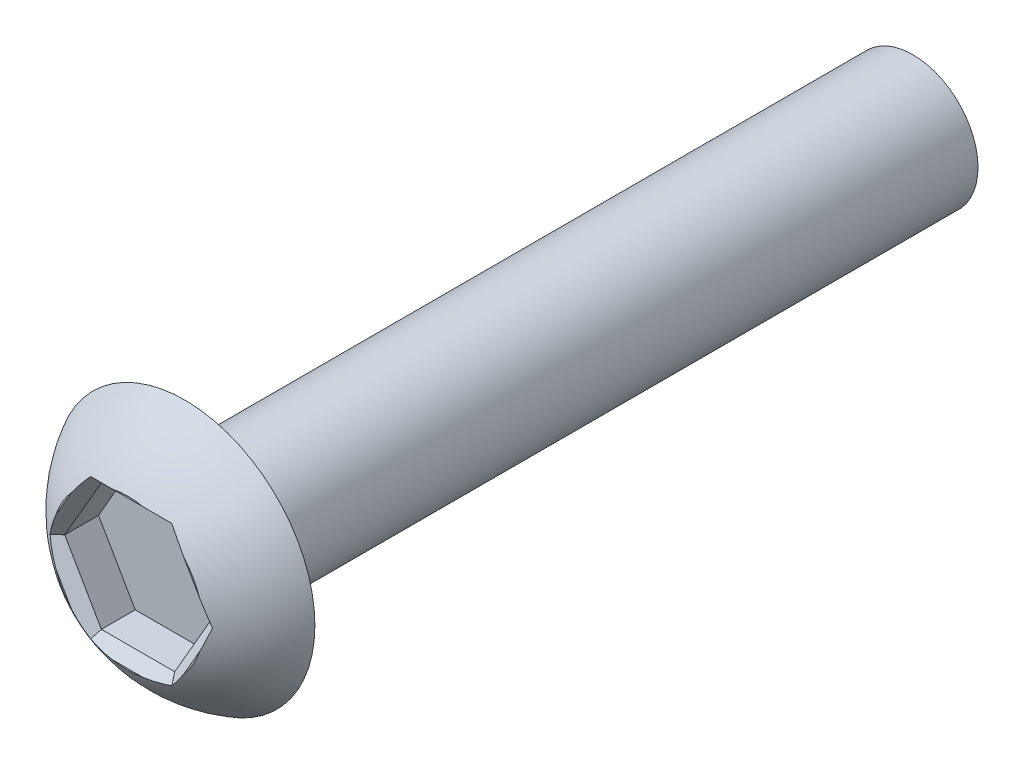
from build123d import *

# Parameters (mm, degrees)
SKETCH1_R               = 1.25
BOSS_EXTRUDE1_DEPTH     = 14
CUT_EXTRUDE1_DEPTH      = 1.25
CUT_EXTRUDE2_DEPTH      = 15.439529078
CUT_EXTRUDE2_DEPTH_BACK = 15.439529078
SKETCH6_W               = 1.249656436
SKETCH6_H               = 4.384153796
CHAMFER2_SIZE           = 0.2


with BuildPart() as part:
    # Sketch1 → Boss-Extrude1 (new body)
    with BuildSketch(Plane.XY):
        Circle(SKETCH1_R)
    extrude(amount=-BOSS_EXTRUDE1_DEPTH)

    # Sketch3 → Revolve1 (revolve)
    with BuildSketch(Plane(origin=(0, 0, 0), x_dir=(0, 0, -1), z_dir=(1, 0, 0)), mode=Mode.PRIVATE) as revolve1_sk:
        with BuildLine():
            ThreePointArc((-1.5, 0), (-1.096229956, 1.457737974), (0, 2.5))
            Line((0, 2.5), (0, 0))
            Line((0, 0), (-1.5, 0))
        make_face()
    revolve(revolve1_sk.sketch.rotate(Axis((0, 0, 1.5), (0, 0, -1)), 180), axis=Axis((0, 0, 1.5), (0, 0, -1)))

    # Sketch5 → Cut-Extrude1 (cut)
    with BuildSketch(Plane(origin=(0, 0, 1.5), x_dir=(-1, 0, 0), z_dir=(0, 0, -1))):
        Polygon((-1.409901945, 0), (-0.704950973, -1.221010901), (0.704950973, -1.221010901), (1.409901945, 0), (0.704950973, 1.221010901), (-0.704950973, 1.221010901), align=None)
    extrude(amount=CUT_EXTRUDE1_DEPTH, mode=Mode.SUBTRACT)

    # Sketch6 → Cut-Extrude2 (cut, two sides: drawn at the far end of the back side and taken through both)
    with BuildSketch(Plane(origin=(0, 0, 0), x_dir=(0, 0, -1), z_dir=(1, 0, 0)).offset(-CUT_EXTRUDE2_DEPTH_BACK)):
        with Locations((-1.724828218, 0.205450463)):
            Rectangle(SKETCH6_W, SKETCH6_H)
    extrude(amount=CUT_EXTRUDE2_DEPTH + CUT_EXTRUDE2_DEPTH_BACK, mode=Mode.SUBTRACT)

    # Chamfer2
    # the kernel refuses this chamfer: 0.2 mm, written as the material it takes off along each edge
    with BuildSketch(Plane(origin=(1.21928757, 1.221010901, 1.1), x_dir=(1.0390370186618431e-14, 0.9996219169112966, 0.02749587661058733), z_dir=(-1, 0, 0))) as chamfer2_piece_1_section:
        Polygon((CHAMFER2_SIZE * 0.999621916911, CHAMFER2_SIZE * 0.0274958766106), (-CHAMFER2_SIZE * 0.0274958766106, CHAMFER2_SIZE * 0.999621916911), (0, 0), align=None)
    chamfer2_piece_1 = extrude(amount=2.43857514, mode=Mode.PRIVATE)
    chamfer2_piece_1 = split(chamfer2_piece_1, bisect_by=Plane(origin=(0.501104512, 1.574083329, 1.032865614), z_dir=(-0.8660254037844416, -0.49999999999999495, 0)), keep=Keep.TOP, mode=Mode.PRIVATE)
    chamfer2_piece_1 = split(chamfer2_piece_1, bisect_by=Plane(origin=(-0.501104512, 1.574083329, 1.032865614), z_dir=(0.8660254037844347, -0.500000000000007, 0)), keep=Keep.TOP, mode=Mode.PRIVATE)
    add(chamfer2_piece_1, mode=Mode.SUBTRACT)
    with BuildSketch(Plane(origin=(1.667070244, -0.44542856, 1.1), x_dir=(0.8656979742248833, 0.4998109584556433, 0.027495876610586282), z_dir=(-0.49999999999999495, 0.8660254037844416, 0))) as chamfer2_piece_2_section:
        Polygon((CHAMFER2_SIZE * 0.999621916911, CHAMFER2_SIZE * 0.0274958766106), (-CHAMFER2_SIZE * 0.0274958766106, CHAMFER2_SIZE * 0.999621916911), (0, 0), align=None)
    chamfer2_piece_2 = extrude(amount=2.43857514, mode=Mode.PRIVATE)
    chamfer2_piece_2 = split(chamfer2_piece_2, bisect_by=Plane(origin=(1.613748406, 0.353072427, 1.032865614), z_dir=(-0.8660254037844382, 0.500000000000001, 0)), keep=Keep.TOP, mode=Mode.PRIVATE)
    chamfer2_piece_2 = split(chamfer2_piece_2, bisect_by=Plane(origin=(1.112643894, 1.221010901, 1.032865614), z_dir=(0, -1, 0)), keep=Keep.TOP, mode=Mode.PRIVATE)
    add(chamfer2_piece_2, mode=Mode.SUBTRACT)
    with BuildSketch(Plane(origin=(0.447782674, -1.666439461, 1.1), x_dir=(0.8656979742248797, -0.4998109584556493, 0.02749587661058626), z_dir=(0.500000000000001, 0.8660254037844382, 0))) as chamfer2_piece_3_section:
        Polygon((CHAMFER2_SIZE * 0.999621916911, CHAMFER2_SIZE * 0.0274958766106), (-CHAMFER2_SIZE * 0.0274958766106, CHAMFER2_SIZE * 0.999621916911), (0, 0), align=None)
    chamfer2_piece_3 = extrude(amount=2.43857514, mode=Mode.PRIVATE)
    chamfer2_piece_3 = split(chamfer2_piece_3, bisect_by=Plane(origin=(1.112643894, -1.221010901, 1.032865614), z_dir=(0, 1, 0)), keep=Keep.TOP, mode=Mode.PRIVATE)
    chamfer2_piece_3 = split(chamfer2_piece_3, bisect_by=Plane(origin=(1.613748406, -0.353072427, 1.032865614), z_dir=(-0.8660254037844416, -0.49999999999999495, 0)), keep=Keep.TOP, mode=Mode.PRIVATE)
    add(chamfer2_piece_3, mode=Mode.SUBTRACT)
    with BuildSketch(Plane(origin=(-1.21928757, -1.221010901, 1.1), x_dir=(-3.30602687756041e-15, -0.9996219169112968, 0.027495876610586285), z_dir=(1, 0, 0))) as chamfer2_piece_4_section:
        Polygon((CHAMFER2_SIZE * 0.999621916911, CHAMFER2_SIZE * 0.0274958766106), (-CHAMFER2_SIZE * 0.0274958766106, CHAMFER2_SIZE * 0.999621916911), (0, 0), align=None)
    chamfer2_piece_4 = extrude(amount=2.43857514, mode=Mode.PRIVATE)
    chamfer2_piece_4 = split(chamfer2_piece_4, bisect_by=Plane(origin=(-0.501104512, -1.574083329, 1.032865614), z_dir=(0.8660254037844417, 0.49999999999999484, 0)), keep=Keep.TOP, mode=Mode.PRIVATE)
    chamfer2_piece_4 = split(chamfer2_piece_4, bisect_by=Plane(origin=(0.501104512, -1.574083329, 1.032865614), z_dir=(-0.8660254037844382, 0.500000000000001, 0)), keep=Keep.TOP, mode=Mode.PRIVATE)
    add(chamfer2_piece_4, mode=Mode.SUBTRACT)
    with BuildSketch(Plane(origin=(-1.667070244, 0.44542856, 1.1), x_dir=(-0.8656979742248834, -0.4998109584556432, 0.027495876610586265), z_dir=(0.49999999999999484, -0.8660254037844417, 0))) as chamfer2_piece_5_section:
        Polygon((CHAMFER2_SIZE * 0.999621916911, CHAMFER2_SIZE * 0.0274958766106), (-CHAMFER2_SIZE * 0.0274958766106, CHAMFER2_SIZE * 0.999621916911), (0, 0), align=None)
    chamfer2_piece_5 = extrude(amount=2.43857514, mode=Mode.PRIVATE)
    chamfer2_piece_5 = split(chamfer2_piece_5, bisect_by=Plane(origin=(-1.112643894, -1.221010901, 1.032865614), z_dir=(0, 1, 0)), keep=Keep.TOP, mode=Mode.PRIVATE)
    chamfer2_piece_5 = split(chamfer2_piece_5, bisect_by=Plane(origin=(-1.613748406, -0.353072427, 1.032865614), z_dir=(0.8660254037844347, -0.500000000000007, 0)), keep=Keep.TOP, mode=Mode.PRIVATE)
    add(chamfer2_piece_5, mode=Mode.SUBTRACT)
    with BuildSketch(Plane(origin=(-0.447782674, 1.666439461, 1.1), x_dir=(-0.8656979742248764, 0.4998109584556554, 0.027495876610586265), z_dir=(-0.500000000000007, -0.8660254037844347, 0))) as chamfer2_piece_6_section:
        Polygon((CHAMFER2_SIZE * 0.999621916911, CHAMFER2_SIZE * 0.0274958766106), (-CHAMFER2_SIZE * 0.0274958766106, CHAMFER2_SIZE * 0.999621916911), (0, 0), align=None)
    chamfer2_piece_6 = extrude(amount=2.43857514, mode=Mode.PRIVATE)
    chamfer2_piece_6 = split(chamfer2_piece_6, bisect_by=Plane(origin=(-1.112643894, 1.221010901, 1.032865614), z_dir=(0, -1, 0)), keep=Keep.TOP, mode=Mode.PRIVATE)
    chamfer2_piece_6 = split(chamfer2_piece_6, bisect_by=Plane(origin=(-1.613748406, 0.353072427, 1.032865614), z_dir=(0.8660254037844417, 0.49999999999999484, 0)), keep=Keep.TOP, mode=Mode.PRIVATE)
    add(chamfer2_piece_6, mode=Mode.SUBTRACT)
    with BuildSketch(Plane(origin=(1.667070244, -0.44542856, 1.1), x_dir=(0.8656979742248833, 0.4998109584556433, 0.027495876610586282), z_dir=(-0.49999999999999495, 0.8660254037844416, 0))) as chamfer2_piece_7a_section:
        Polygon((CHAMFER2_SIZE * 0.999621916911, CHAMFER2_SIZE * 0.0274958766106), (-CHAMFER2_SIZE * 0.0274958766106, CHAMFER2_SIZE * 0.999621916911), (0, 0), align=None)
    chamfer2_piece_7a = extrude(amount=2.43857514, mode=Mode.PRIVATE)
    chamfer2_piece_7a = split(chamfer2_piece_7a, bisect_by=Plane(origin=(0.645691333, 1.221010901, 1.035460513), z_dir=(0, 1, 0)), keep=Keep.TOP, mode=Mode.PRIVATE)
    with BuildSketch(Plane(origin=(1.21928757, 1.221010901, 1.1), x_dir=(1.0390370186618431e-14, 0.9996219169112966, 0.02749587661058733), z_dir=(-1, 0, 0))) as chamfer2_piece_7b_section:
        Polygon((CHAMFER2_SIZE * 0.999621916911, CHAMFER2_SIZE * 0.0274958766106), (-CHAMFER2_SIZE * 0.0274958766106, CHAMFER2_SIZE * 0.999621916911), (0, 0), align=None)
    chamfer2_piece_7b = extrude(amount=2.43857514, mode=Mode.PRIVATE)
    chamfer2_piece_7b = split(chamfer2_piece_7b, bisect_by=Plane(origin=(0.734580793, 1.169690548, 1.035460513), z_dir=(0.8660254037844416, 0.49999999999999495, 0)), keep=Keep.TOP, mode=Mode.PRIVATE)
    chamfer2_piece_7 = chamfer2_piece_7a & chamfer2_piece_7b
    add(chamfer2_piece_7, mode=Mode.SUBTRACT)
    with BuildSketch(Plane(origin=(1.21928757, 1.221010901, 1.1), x_dir=(1.0390370186618431e-14, 0.9996219169112966, 0.02749587661058733), z_dir=(-1, 0, 0))) as chamfer2_piece_8a_section:
        Polygon((CHAMFER2_SIZE * 0.999621916911, CHAMFER2_SIZE * 0.0274958766106), (-CHAMFER2_SIZE * 0.0274958766106, CHAMFER2_SIZE * 0.999621916911), (0, 0), align=None)
    chamfer2_piece_8a = extrude(amount=2.43857514, mode=Mode.PRIVATE)
    chamfer2_piece_8a = split(chamfer2_piece_8a, bisect_by=Plane(origin=(-0.734580793, 1.169690548, 1.035460513), z_dir=(-0.8660254037844347, 0.500000000000007, 0)), keep=Keep.TOP, mode=Mode.PRIVATE)
    with BuildSketch(Plane(origin=(-0.447782674, 1.666439461, 1.1), x_dir=(-0.8656979742248764, 0.4998109584556554, 0.027495876610586265), z_dir=(-0.500000000000007, -0.8660254037844347, 0))) as chamfer2_piece_8b_section:
        Polygon((CHAMFER2_SIZE * 0.999621916911, CHAMFER2_SIZE * 0.0274958766106), (-CHAMFER2_SIZE * 0.0274958766106, CHAMFER2_SIZE * 0.999621916911), (0, 0), align=None)
    chamfer2_piece_8b = extrude(amount=2.43857514, mode=Mode.PRIVATE)
    chamfer2_piece_8b = split(chamfer2_piece_8b, bisect_by=Plane(origin=(-0.645691333, 1.221010901, 1.035460513), z_dir=(0, 1, 0)), keep=Keep.TOP, mode=Mode.PRIVATE)
    chamfer2_piece_8 = chamfer2_piece_8a & chamfer2_piece_8b
    add(chamfer2_piece_8, mode=Mode.SUBTRACT)
    with BuildSketch(Plane(origin=(0.447782674, -1.666439461, 1.1), x_dir=(0.8656979742248797, -0.4998109584556493, 0.02749587661058626), z_dir=(0.500000000000001, 0.8660254037844382, 0))) as chamfer2_piece_9a_section:
        Polygon((CHAMFER2_SIZE * 0.999621916911, CHAMFER2_SIZE * 0.0274958766106), (-CHAMFER2_SIZE * 0.0274958766106, CHAMFER2_SIZE * 0.999621916911), (0, 0), align=None)
    chamfer2_piece_9a = extrude(amount=2.43857514, mode=Mode.PRIVATE)
    chamfer2_piece_9a = split(chamfer2_piece_9a, bisect_by=Plane(origin=(1.380272125, 0.051320354, 1.035460513), z_dir=(0.8660254037844416, 0.49999999999999495, 0)), keep=Keep.TOP, mode=Mode.PRIVATE)
    with BuildSketch(Plane(origin=(1.667070244, -0.44542856, 1.1), x_dir=(0.8656979742248833, 0.4998109584556433, 0.027495876610586282), z_dir=(-0.49999999999999495, 0.8660254037844416, 0))) as chamfer2_piece_9b_section:
        Polygon((CHAMFER2_SIZE * 0.999621916911, CHAMFER2_SIZE * 0.0274958766106), (-CHAMFER2_SIZE * 0.0274958766106, CHAMFER2_SIZE * 0.999621916911), (0, 0), align=None)
    chamfer2_piece_9b = extrude(amount=2.43857514, mode=Mode.PRIVATE)
    chamfer2_piece_9b = split(chamfer2_piece_9b, bisect_by=Plane(origin=(1.380272125, -0.051320354, 1.035460513), z_dir=(0.8660254037844382, -0.500000000000001, 0)), keep=Keep.TOP, mode=Mode.PRIVATE)
    chamfer2_piece_9 = chamfer2_piece_9a & chamfer2_piece_9b
    add(chamfer2_piece_9, mode=Mode.SUBTRACT)
    with BuildSketch(Plane(origin=(-1.21928757, -1.221010901, 1.1), x_dir=(-3.30602687756041e-15, -0.9996219169112968, 0.027495876610586285), z_dir=(1, 0, 0))) as chamfer2_piece_10a_section:
        Polygon((CHAMFER2_SIZE * 0.999621916911, CHAMFER2_SIZE * 0.0274958766106), (-CHAMFER2_SIZE * 0.0274958766106, CHAMFER2_SIZE * 0.999621916911), (0, 0), align=None)
    chamfer2_piece_10a = extrude(amount=2.43857514, mode=Mode.PRIVATE)
    chamfer2_piece_10a = split(chamfer2_piece_10a, bisect_by=Plane(origin=(0.734580793, -1.169690548, 1.035460513), z_dir=(0.8660254037844382, -0.500000000000001, 0)), keep=Keep.TOP, mode=Mode.PRIVATE)
    with BuildSketch(Plane(origin=(0.447782674, -1.666439461, 1.1), x_dir=(0.8656979742248797, -0.4998109584556493, 0.02749587661058626), z_dir=(0.500000000000001, 0.8660254037844382, 0))) as chamfer2_piece_10b_section:
        Polygon((CHAMFER2_SIZE * 0.999621916911, CHAMFER2_SIZE * 0.0274958766106), (-CHAMFER2_SIZE * 0.0274958766106, CHAMFER2_SIZE * 0.999621916911), (0, 0), align=None)
    chamfer2_piece_10b = extrude(amount=2.43857514, mode=Mode.PRIVATE)
    chamfer2_piece_10b = split(chamfer2_piece_10b, bisect_by=Plane(origin=(0.645691333, -1.221010901, 1.035460513), z_dir=(0, -1, 0)), keep=Keep.TOP, mode=Mode.PRIVATE)
    chamfer2_piece_10 = chamfer2_piece_10a & chamfer2_piece_10b
    add(chamfer2_piece_10, mode=Mode.SUBTRACT)
    with BuildSketch(Plane(origin=(-1.21928757, -1.221010901, 1.1), x_dir=(-3.30602687756041e-15, -0.9996219169112968, 0.027495876610586285), z_dir=(1, 0, 0))) as chamfer2_piece_11a_section:
        Polygon((CHAMFER2_SIZE * 0.999621916911, CHAMFER2_SIZE * 0.0274958766106), (-CHAMFER2_SIZE * 0.0274958766106, CHAMFER2_SIZE * 0.999621916911), (0, 0), align=None)
    chamfer2_piece_11a = extrude(amount=2.43857514, mode=Mode.PRIVATE)
    chamfer2_piece_11a = split(chamfer2_piece_11a, bisect_by=Plane(origin=(-0.734580793, -1.169690548, 1.035460513), z_dir=(-0.8660254037844417, -0.49999999999999484, 0)), keep=Keep.TOP, mode=Mode.PRIVATE)
    with BuildSketch(Plane(origin=(-1.667070244, 0.44542856, 1.1), x_dir=(-0.8656979742248834, -0.4998109584556432, 0.027495876610586265), z_dir=(0.49999999999999484, -0.8660254037844417, 0))) as chamfer2_piece_11b_section:
        Polygon((CHAMFER2_SIZE * 0.999621916911, CHAMFER2_SIZE * 0.0274958766106), (-CHAMFER2_SIZE * 0.0274958766106, CHAMFER2_SIZE * 0.999621916911), (0, 0), align=None)
    chamfer2_piece_11b = extrude(amount=2.43857514, mode=Mode.PRIVATE)
    chamfer2_piece_11b = split(chamfer2_piece_11b, bisect_by=Plane(origin=(-0.645691333, -1.221010901, 1.035460513), z_dir=(0, -1, 0)), keep=Keep.TOP, mode=Mode.PRIVATE)
    chamfer2_piece_11 = chamfer2_piece_11a & chamfer2_piece_11b
    add(chamfer2_piece_11, mode=Mode.SUBTRACT)
    with BuildSketch(Plane(origin=(-0.447782674, 1.666439461, 1.1), x_dir=(-0.8656979742248764, 0.4998109584556554, 0.027495876610586265), z_dir=(-0.500000000000007, -0.8660254037844347, 0))) as chamfer2_piece_12a_section:
        Polygon((CHAMFER2_SIZE * 0.999621916911, CHAMFER2_SIZE * 0.0274958766106), (-CHAMFER2_SIZE * 0.0274958766106, CHAMFER2_SIZE * 0.999621916911), (0, 0), align=None)
    chamfer2_piece_12a = extrude(amount=2.43857514, mode=Mode.PRIVATE)
    chamfer2_piece_12a = split(chamfer2_piece_12a, bisect_by=Plane(origin=(-1.380272125, -0.051320354, 1.035460513), z_dir=(-0.8660254037844417, -0.49999999999999484, 0)), keep=Keep.TOP, mode=Mode.PRIVATE)
    with BuildSketch(Plane(origin=(-1.667070244, 0.44542856, 1.1), x_dir=(-0.8656979742248834, -0.4998109584556432, 0.027495876610586265), z_dir=(0.49999999999999484, -0.8660254037844417, 0))) as chamfer2_piece_12b_section:
        Polygon((CHAMFER2_SIZE * 0.999621916911, CHAMFER2_SIZE * 0.0274958766106), (-CHAMFER2_SIZE * 0.0274958766106, CHAMFER2_SIZE * 0.999621916911), (0, 0), align=None)
    chamfer2_piece_12b = extrude(amount=2.43857514, mode=Mode.PRIVATE)
    chamfer2_piece_12b = split(chamfer2_piece_12b, bisect_by=Plane(origin=(-1.380272125, 0.051320354, 1.035460513), z_dir=(-0.8660254037844347, 0.500000000000007, 0)), keep=Keep.TOP, mode=Mode.PRIVATE)
    chamfer2_piece_12 = chamfer2_piece_12a & chamfer2_piece_12b
    add(chamfer2_piece_12, mode=Mode.SUBTRACT)


solid = part.part
